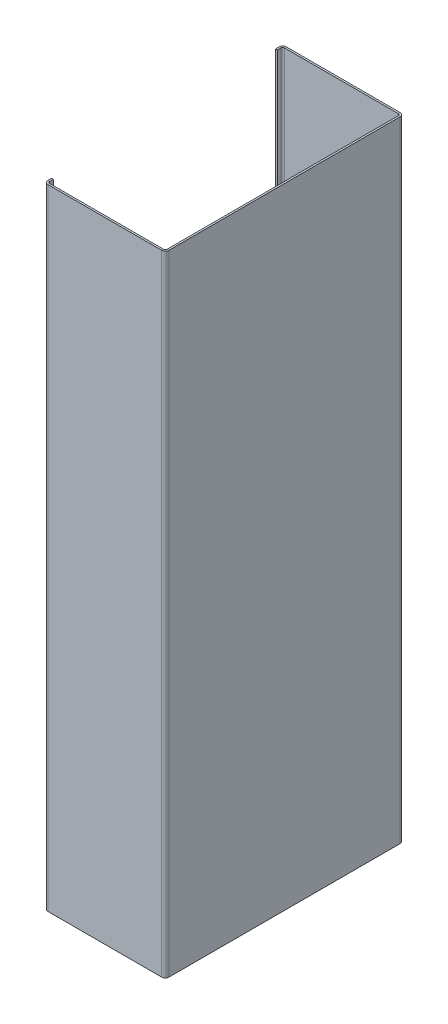
from build123d import *

# Parameters (mm, degrees)
SM_BASE_FLANGE_1_DEPTH = 260


# Sheet-metal steps are written as plain solids
with BuildPart() as part:
    # Sketch 1 → Базовая кромка1 (new body)
    with BuildSketch(Plane(origin=(0, 0, 0), x_dir=(1, 0, 0), z_dir=(0, 1, 0))):
        with BuildLine():
            Line((-50, 46.25), (-50, 47.75))
            ThreePointArc((-50, 47.75), (-49.560660172, 48.810660172), (-48.5, 49.25))
            Line((-48.5, 49.25), (-1.5, 49.25))
            ThreePointArc((-1.5, 49.25), (-0.439339828, 48.810660172), (0, 47.75))
            Line((0, 47.75), (0, -47.75))
            ThreePointArc((0, -47.75), (-0.439339828, -48.810660172), (-1.5, -49.25))
            Line((-1.5, -49.25), (-48.5, -49.25))
            ThreePointArc((-48.5, -49.25), (-49.560660172, -48.810660172), (-50, -47.75))
            Line((-50, -47.75), (-50, -46.25))
            Line((-50, -46.25), (-49.25, -46.25))
            Line((-49.25, -46.25), (-49.25, -47.75))
            ThreePointArc((-49.25, -47.75), (-49.030330086, -48.280330086), (-48.5, -48.5))
            Line((-48.5, -48.5), (-1.5, -48.5))
            ThreePointArc((-1.5, -48.5), (-0.969669914, -48.280330086), (-0.75, -47.75))
            Line((-0.75, -47.75), (-0.75, 47.75))
            ThreePointArc((-0.75, 47.75), (-0.969669914, 48.280330086), (-1.5, 48.5))
            Line((-1.5, 48.5), (-48.5, 48.5))
            ThreePointArc((-48.5, 48.5), (-49.030330086, 48.280330086), (-49.25, 47.75))
            Line((-49.25, 47.75), (-49.25, 46.25))
            Line((-49.25, 46.25), (-50, 46.25))
        make_face()
    extrude(amount=SM_BASE_FLANGE_1_DEPTH)


solid = part.part
